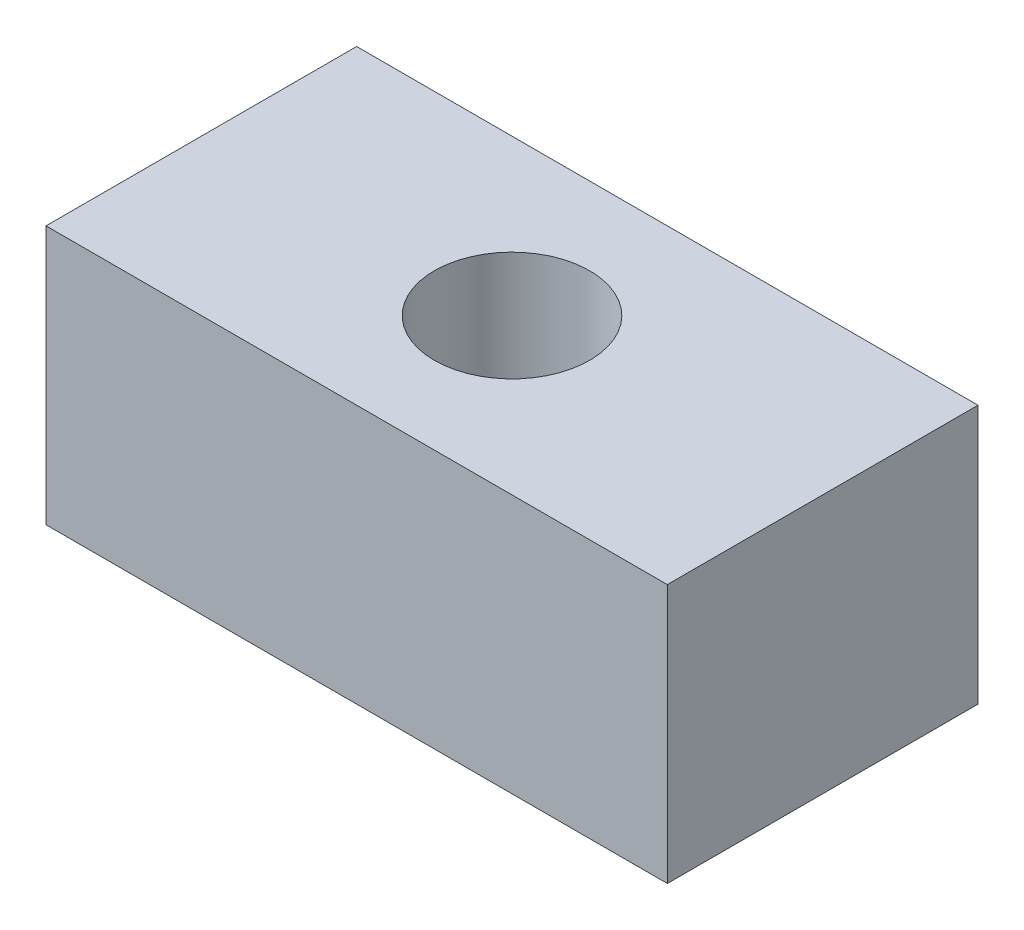
from build123d import *

# Parameters (mm, degrees)
SKETCH1_W           = 12
SKETCH1_H           = 6
SKETCH1_R           = 1.5
BOSS_EXTRUDE1_DEPTH = 5


with BuildPart() as part:
    # Sketch1 → Boss-Extrude1 (new body)
    with BuildSketch(Plane(origin=(0, 0, 0), x_dir=(1, 0, 0), z_dir=(0, 1, 0))):
        Rectangle(SKETCH1_W, SKETCH1_H)
        Circle(SKETCH1_R, mode=Mode.SUBTRACT)
    extrude(amount=BOSS_EXTRUDE1_DEPTH)


solid = part.part
